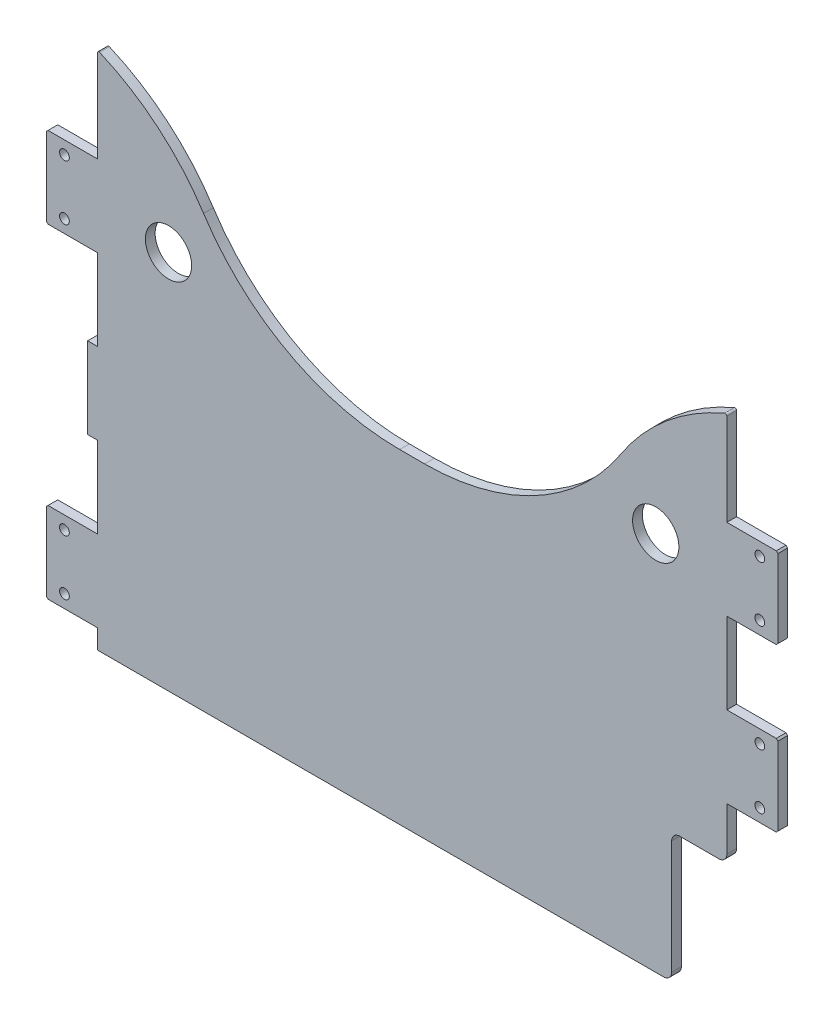
from build123d import *

# Parameters (mm, degrees)
ESBO_O1_W                = 387.6
ESBO_O1_H                = 320
RESSALTO_EXTRUS_O1_DEPTH = 6
CORTE_EXTRUS_O1_DEPTH    = 503.662670187
ESBO_O3_R                = 14.25
CORTE_EXTRUS_O2_DEPTH    = 503.662670187
FILETE1_R                = 144
FILETE2_R                = 144
ESBO_O4_W                = 6
ESBO_O4_H                = 50
RESSALTO_EXTRUS_O2_DEPTH = 31.4
ESBO_O5_W                = 25.4
ESBO_O5_H                = 50
CORTE_EXTRUS_O3_DEPTH    = 528.25420828
ESBO_O6_W                = 40
ESBO_O6_H                = 80
CORTE_EXTRUS_O4_DEPTH    = 528.25420828
FILETE3_R                = 5
CHANFRO1_SIZE            = 1
FILETE4_R                = 1
ESBO_O8_R                = 3
CORTE_EXTRUS_O5_DEPTH    = 527.945845339


with BuildPart() as part:
    # Esboço1 → Ressalto-extrusão1 (new body)
    with BuildSketch(Plane.XY):
        with Locations((193.8, 160)):
            Rectangle(ESBO_O1_W, ESBO_O1_H)
    extrude(amount=RESSALTO_EXTRUS_O1_DEPTH)

    # Esboço2 → Corte-extrusão1 (cut, through all)
    with BuildSketch(Plane.XY.offset(6)):
        Polygon((33.8, 320), (103.8, 200), (283.8, 200), (353.8, 320), align=None)
    extrude(amount=-CORTE_EXTRUS_O1_DEPTH, mode=Mode.SUBTRACT)

    # Esboço3 → Corte-extrusão2 (cut, through all)
    with BuildSketch(Plane.XY.offset(6)):
        with Locations((43.8, 234)):
            Circle(ESBO_O3_R)
        with Locations(Location((343.8, 234, 0), (0, 0, 180))):
            Circle(ESBO_O3_R)
    extrude(amount=-CORTE_EXTRUS_O2_DEPTH, mode=Mode.SUBTRACT)

    # Filete1
    # the kernel refuses this fillet: 144 mm, written as the material it takes off along each edge
    with BuildSketch(Plane(origin=(353.8, 320, 180.735732562), x_dir=(1, 0, 0), z_dir=(0, 0, -1))) as filete1_piece_1:
        with BuildLine():
            CenterArc((89.166452625, 132.930643283), FILETE1_R, 210.256437164, 37.131526626)
            Line((-35.217709105, 60.373215608), (-37.705392339, 58.922067054))
            Line((-37.705392339, 58.922067054), (-2.487683235, -1.451148554))
            Line((-2.487683235, -1.451148554), (0, -2.88))
            ThreePointArc((0, -2.88), (16.9, -2.88), (32.692670948, -2.658612866))
            Line((32.692670948, -2.658612866), (33.8, 0))
        make_face()
    extrude(amount=355.471465124, mode=Mode.SUBTRACT)
    with BuildSketch(Plane(origin=(33.8, 320, 180.735732562), x_dir=(-1, 0, 0), z_dir=(0, 0, -1))) as filete1_piece_2:
        with BuildLine():
            CenterArc((89.166452625, -132.930643283), FILETE1_R, 112.612036211, 37.131526626)
            Line((-35.217709105, -60.373215608), (-37.705392339, -58.922067054))
            Line((-37.705392339, -58.922067054), (-2.487683235, 1.451148554))
            Line((-2.487683235, 1.451148554), (0, 2.88))
            ThreePointArc((0, 2.88), (16.9, 2.88), (32.692670948, 2.658612866))
            Line((32.692670948, 2.658612866), (33.8, 0))
        make_face()
    extrude(amount=355.471465124, mode=Mode.SUBTRACT)

    # Filete2
    filete2_edges = [part.edges().sort_by_distance(p)[0] for p in [
        (283.8, 200, 3),
        (103.8, 200, 3),
    ]]
    fillet(filete2_edges, radius=FILETE2_R)

    # Esboço4 → Ressalto-extrusão2 (add)
    with BuildSketch(Plane.ZY):
        with Locations((3, 236.902997942)):
            Rectangle(ESBO_O4_W, ESBO_O4_H)
        with Locations((3, 136.902997942)):
            Rectangle(ESBO_O4_W, ESBO_O4_H)
        with Locations((3, 36.902997942)):
            Rectangle(ESBO_O4_W, ESBO_O4_H)
    ressalto_extrus_o2 = extrude(amount=RESSALTO_EXTRUS_O2_DEPTH)

    # Espelhar1: Ressalto-extrusão2 across plane
    add(ressalto_extrus_o2.mirror(Plane.ZY.offset(-193.8)))

    # Esboço5 → Corte-extrusão3 (cut, through all)
    with BuildSketch(Plane.XY.offset(6)):
        with Locations((406.3, 36.902997942)):
            Rectangle(ESBO_O5_W, ESBO_O5_H)
        with Locations((-18.7, 136.902997942)):
            Rectangle(ESBO_O5_W, ESBO_O5_H)
    extrude(amount=-CORTE_EXTRUS_O3_DEPTH, mode=Mode.SUBTRACT)

    # Esboço6 → Corte-extrusão4 (cut, through all)
    with BuildSketch(Plane.XY.offset(6)):
        with Locations((373.6, 40)):
            Rectangle(ESBO_O6_W, ESBO_O6_H)
    extrude(amount=-CORTE_EXTRUS_O4_DEPTH, mode=Mode.SUBTRACT)

    # Filete3
    filete3_edges = [part.edges().sort_by_distance(p)[0] for p in [
        (387.6, 80, 3),
        (353.6, 80, 3),
        (353.6, 0, 3),
    ]]
    fillet(filete3_edges, radius=FILETE3_R)

    # Chanfro1
    chanfro1_edges = [part.edges().sort_by_distance(p)[0] for p in [
        (-31.4, 61.902997942, 3),
        (-31.4, 11.902997942, 3),
        (419, 261.902997942, 3),
        (419, 211.902997942, 3),
        (419, 161.902997942, 3),
        (419, 111.902997942, 3),
        (-31.4, 261.902997942, 3),
        (-31.4, 211.902997942, 3),
    ]]
    chamfer(chanfro1_edges, length=CHANFRO1_SIZE)

    # Filete4
    filete4_edges = [part.edges().sort_by_distance(p)[0] for p in [
        (0, 320, 3),
        (387.6, 320, 3),
    ]]
    fillet(filete4_edges, radius=FILETE4_R)

    # Esboço8 → Corte-extrusão5 (cut, through all)
    with BuildSketch(Plane.XY.offset(6)):
        with Locations((407.9, 253.902997942)):
            Circle(ESBO_O8_R)
        with Locations((407.9, 219.902997942)):
            Circle(ESBO_O8_R)
        with Locations((407.9, 153.902997942)):
            Circle(ESBO_O8_R)
        with Locations((407.9, 119.902997942)):
            Circle(ESBO_O8_R)
        with Locations((-20.3, 19.902997942)):
            Circle(ESBO_O8_R)
        with Locations((-20.3, 53.902997942)):
            Circle(ESBO_O8_R)
        with Locations((-20.3, 219.902997942)):
            Circle(ESBO_O8_R)
        with Locations((-20.3, 253.902997942)):
            Circle(ESBO_O8_R)
    extrude(amount=-CORTE_EXTRUS_O5_DEPTH, mode=Mode.SUBTRACT)


solid = part.part
